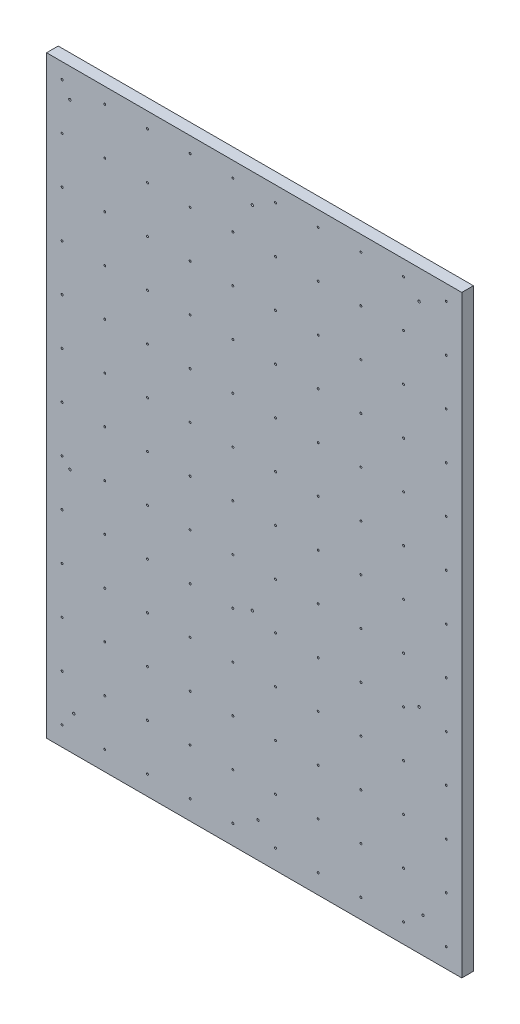
from build123d import *

# Parameters (mm, degrees)
SKETCH_1_W          = 1070
SKETCH_1_H          = 1530
EXTRUDE_1_DEPTH     = 15
SKETCH_2_R          = 2.5
CUT_EXTRUDE_1_DEPTH = 934.996788003
SKETCH_3_R          = 3
CUT_EXTRUDE_2_DEPTH = 934.996788003
SKETCH_4_R          = 3
CUT_EXTRUDE_3_DEPTH = 934.996788003


with BuildPart() as part:
    # Эскиз1 → Бобышка-Вытянуть1 (new, symmetric)
    with BuildSketch(Plane.XY):
        Rectangle(SKETCH_1_W, SKETCH_1_H)
    extrude(amount=EXTRUDE_1_DEPTH, both=True)

    # Эскиз2 → Вырез-Вытянуть1 (cut, through all)
    with BuildSketch(Plane.XY.offset(15)):
        with Locations((-495, 725)):
            Circle(SKETCH_2_R)
        with Locations((-385, 725)):
            Circle(SKETCH_2_R)
        with Locations((-275, 725)):
            Circle(SKETCH_2_R)
        with Locations((-165, 725)):
            Circle(SKETCH_2_R)
        with Locations((-55, 725)):
            Circle(SKETCH_2_R)
        with Locations((55, 725)):
            Circle(SKETCH_2_R)
        with Locations((165, 725)):
            Circle(SKETCH_2_R)
        with Locations((275, 725)):
            Circle(SKETCH_2_R)
        with Locations((385, 725)):
            Circle(SKETCH_2_R)
        with Locations((495, 725)):
            Circle(SKETCH_2_R)
        with Locations((-385, 605)):
            Circle(SKETCH_2_R)
        with Locations((-275, 605)):
            Circle(SKETCH_2_R)
        with Locations((-165, 605)):
            Circle(SKETCH_2_R)
        with Locations((-55, 605)):
            Circle(SKETCH_2_R)
        with Locations((55, 605)):
            Circle(SKETCH_2_R)
        with Locations((165, 605)):
            Circle(SKETCH_2_R)
        with Locations((275, 605)):
            Circle(SKETCH_2_R)
        with Locations((385, 605)):
            Circle(SKETCH_2_R)
        with Locations((495, 605)):
            Circle(SKETCH_2_R)
        with Locations((-385, 485)):
            Circle(SKETCH_2_R)
        with Locations((-275, 485)):
            Circle(SKETCH_2_R)
        with Locations((-165, 485)):
            Circle(SKETCH_2_R)
        with Locations((-55, 485)):
            Circle(SKETCH_2_R)
        with Locations((55, 485)):
            Circle(SKETCH_2_R)
        with Locations((165, 485)):
            Circle(SKETCH_2_R)
        with Locations((275, 485)):
            Circle(SKETCH_2_R)
        with Locations((385, 485)):
            Circle(SKETCH_2_R)
        with Locations((495, 485)):
            Circle(SKETCH_2_R)
        with Locations((-385, 365)):
            Circle(SKETCH_2_R)
        with Locations((-275, 365)):
            Circle(SKETCH_2_R)
        with Locations((-165, 365)):
            Circle(SKETCH_2_R)
        with Locations((-55, 365)):
            Circle(SKETCH_2_R)
        with Locations((55, 365)):
            Circle(SKETCH_2_R)
        with Locations((165, 365)):
            Circle(SKETCH_2_R)
        with Locations((275, 365)):
            Circle(SKETCH_2_R)
        with Locations((385, 365)):
            Circle(SKETCH_2_R)
        with Locations((495, 365)):
            Circle(SKETCH_2_R)
        with Locations((-385, 245)):
            Circle(SKETCH_2_R)
        with Locations((-275, 245)):
            Circle(SKETCH_2_R)
        with Locations((-165, 245)):
            Circle(SKETCH_2_R)
        with Locations((-55, 245)):
            Circle(SKETCH_2_R)
        with Locations((55, 245)):
            Circle(SKETCH_2_R)
        with Locations((165, 245)):
            Circle(SKETCH_2_R)
        with Locations((275, 245)):
            Circle(SKETCH_2_R)
        with Locations((385, 245)):
            Circle(SKETCH_2_R)
        with Locations((495, 245)):
            Circle(SKETCH_2_R)
        with Locations((-385, 125)):
            Circle(SKETCH_2_R)
        with Locations((-275, 125)):
            Circle(SKETCH_2_R)
        with Locations((-165, 125)):
            Circle(SKETCH_2_R)
        with Locations((-55, 125)):
            Circle(SKETCH_2_R)
        with Locations((55, 125)):
            Circle(SKETCH_2_R)
        with Locations((165, 125)):
            Circle(SKETCH_2_R)
        with Locations((275, 125)):
            Circle(SKETCH_2_R)
        with Locations((385, 125)):
            Circle(SKETCH_2_R)
        with Locations((495, 125)):
            Circle(SKETCH_2_R)
        with Locations((-385, 5)):
            Circle(SKETCH_2_R)
        with Locations((-275, 5)):
            Circle(SKETCH_2_R)
        with Locations((-165, 5)):
            Circle(SKETCH_2_R)
        with Locations((-55, 5)):
            Circle(SKETCH_2_R)
        with Locations((55, 5)):
            Circle(SKETCH_2_R)
        with Locations((165, 5)):
            Circle(SKETCH_2_R)
        with Locations((275, 5)):
            Circle(SKETCH_2_R)
        with Locations((385, 5)):
            Circle(SKETCH_2_R)
        with Locations((495, 5)):
            Circle(SKETCH_2_R)
        with Locations((-385, -115)):
            Circle(SKETCH_2_R)
        with Locations((-275, -115)):
            Circle(SKETCH_2_R)
        with Locations((-165, -115)):
            Circle(SKETCH_2_R)
        with Locations((-55, -115)):
            Circle(SKETCH_2_R)
        with Locations((55, -115)):
            Circle(SKETCH_2_R)
        with Locations((165, -115)):
            Circle(SKETCH_2_R)
        with Locations((275, -115)):
            Circle(SKETCH_2_R)
        with Locations((385, -115)):
            Circle(SKETCH_2_R)
        with Locations((495, -115)):
            Circle(SKETCH_2_R)
        with Locations((-385, -235)):
            Circle(SKETCH_2_R)
        with Locations((-275, -235)):
            Circle(SKETCH_2_R)
        with Locations((-165, -235)):
            Circle(SKETCH_2_R)
        with Locations((-55, -235)):
            Circle(SKETCH_2_R)
        with Locations((55, -235)):
            Circle(SKETCH_2_R)
        with Locations((165, -235)):
            Circle(SKETCH_2_R)
        with Locations((275, -235)):
            Circle(SKETCH_2_R)
        with Locations((385, -235)):
            Circle(SKETCH_2_R)
        with Locations((495, -235)):
            Circle(SKETCH_2_R)
        with Locations((-385, -355)):
            Circle(SKETCH_2_R)
        with Locations((-275, -355)):
            Circle(SKETCH_2_R)
        with Locations((-165, -355)):
            Circle(SKETCH_2_R)
        with Locations((-55, -355)):
            Circle(SKETCH_2_R)
        with Locations((55, -355)):
            Circle(SKETCH_2_R)
        with Locations((165, -355)):
            Circle(SKETCH_2_R)
        with Locations((275, -355)):
            Circle(SKETCH_2_R)
        with Locations((385, -355)):
            Circle(SKETCH_2_R)
        with Locations((495, -355)):
            Circle(SKETCH_2_R)
        with Locations((-385, -475)):
            Circle(SKETCH_2_R)
        with Locations((-275, -475)):
            Circle(SKETCH_2_R)
        with Locations((-165, -475)):
            Circle(SKETCH_2_R)
        with Locations((-55, -475)):
            Circle(SKETCH_2_R)
        with Locations((55, -475)):
            Circle(SKETCH_2_R)
        with Locations((165, -475)):
            Circle(SKETCH_2_R)
        with Locations((275, -475)):
            Circle(SKETCH_2_R)
        with Locations((385, -475)):
            Circle(SKETCH_2_R)
        with Locations((495, -475)):
            Circle(SKETCH_2_R)
        with Locations((-385, -595)):
            Circle(SKETCH_2_R)
        with Locations((-275, -595)):
            Circle(SKETCH_2_R)
        with Locations((-165, -595)):
            Circle(SKETCH_2_R)
        with Locations((-55, -595)):
            Circle(SKETCH_2_R)
        with Locations((55, -595)):
            Circle(SKETCH_2_R)
        with Locations((165, -595)):
            Circle(SKETCH_2_R)
        with Locations((275, -595)):
            Circle(SKETCH_2_R)
        with Locations((385, -595)):
            Circle(SKETCH_2_R)
        with Locations((495, -595)):
            Circle(SKETCH_2_R)
        with Locations((-385, -715)):
            Circle(SKETCH_2_R)
        with Locations((-275, -715)):
            Circle(SKETCH_2_R)
        with Locations((-165, -715)):
            Circle(SKETCH_2_R)
        with Locations((-55, -715)):
            Circle(SKETCH_2_R)
        with Locations((55, -715)):
            Circle(SKETCH_2_R)
        with Locations((165, -715)):
            Circle(SKETCH_2_R)
        with Locations((275, -715)):
            Circle(SKETCH_2_R)
        with Locations((385, -715)):
            Circle(SKETCH_2_R)
        with Locations((495, -715)):
            Circle(SKETCH_2_R)
        with Locations((-495, 605)):
            Circle(SKETCH_2_R)
        with Locations((-495, 485)):
            Circle(SKETCH_2_R)
        with Locations((-495, 365)):
            Circle(SKETCH_2_R)
        with Locations((-495, 245)):
            Circle(SKETCH_2_R)
        with Locations((-495, 125)):
            Circle(SKETCH_2_R)
        with Locations((-495, 5)):
            Circle(SKETCH_2_R)
        with Locations((-495, -115)):
            Circle(SKETCH_2_R)
        with Locations((-495, -235)):
            Circle(SKETCH_2_R)
        with Locations((-495, -355)):
            Circle(SKETCH_2_R)
        with Locations((-495, -475)):
            Circle(SKETCH_2_R)
        with Locations((-495, -595)):
            Circle(SKETCH_2_R)
        with Locations((-495, -715)):
            Circle(SKETCH_2_R)
    extrude(amount=-CUT_EXTRUDE_1_DEPTH, mode=Mode.SUBTRACT)

    # Эскиз3 → Вырез-Вытянуть2 (cut, through all)
    with BuildSketch(Plane.XY.offset(15)):
        with Locations((-475, 690)):
            Circle(SKETCH_3_R)
        with Locations((-5, 690)):
            Circle(SKETCH_3_R)
        with Locations((425, 690)):
            Circle(SKETCH_3_R)
        with Locations((-475, -135)):
            Circle(SKETCH_3_R)
        with Locations((-5, -215)):
            Circle(SKETCH_3_R)
        with Locations((425, -215)):
            Circle(SKETCH_3_R)
    extrude(amount=-CUT_EXTRUDE_2_DEPTH, mode=Mode.SUBTRACT)

    # Эскиз4 → Вырез-Вытянуть3 (cut, through all)
    with BuildSketch(Plane.XY.offset(15)):
        with Locations((435, -675)):
            Circle(SKETCH_4_R)
        with Locations((10, -675)):
            Circle(SKETCH_4_R)
        with Locations((-465, -675)):
            Circle(SKETCH_4_R)
    extrude(amount=-CUT_EXTRUDE_3_DEPTH, mode=Mode.SUBTRACT)


solid = part.part
